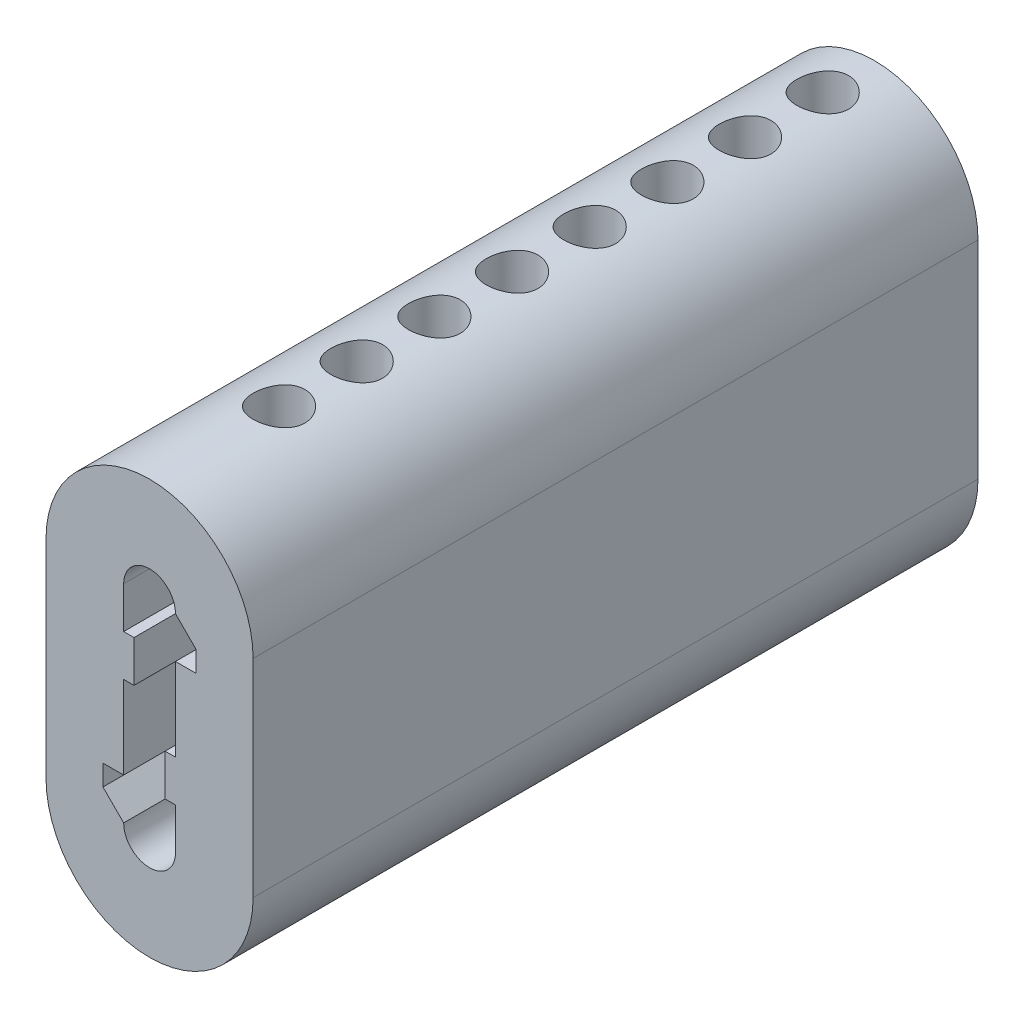
from build123d import *

# Parameters (mm, degrees)
FIRST_EXTURSION_DEPTH = 70
CUT_FOR_KEY_DEPTH     = 70
UPPER_PINS_START      = 9.9999999
UPPER_PINS_OUTLINE_R  = 2.5
UPPER_PINS_DEPTH      = 11.0000001
SZKIC4_W              = 2.5
SZKIC4_H              = 14
DOWN_PINS_AT_2_COUNT  = 2
DOWN_PINS_AT_2_PITCH  = 52.5
DOWN_PINS_AT_3_COUNT  = 2
DOWN_PINS_AT_3_PITCH  = 45
DOWN_PINS_AT_4_COUNT  = 2
DOWN_PINS_AT_4_PITCH  = 37.5
DOWN_PINS_AT_5_COUNT  = 2
DOWN_PINS_AT_5_PITCH  = 30
DOWN_PINS_AT_6_COUNT  = 2
DOWN_PINS_AT_6_PITCH  = 22.5
DOWN_PINS_AT_7_COUNT  = 2
DOWN_PINS_AT_7_PITCH  = 15
DOWN_PINS_AT_8_COUNT  = 2
DOWN_PINS_AT_8_PITCH  = 7.5


with BuildPart() as part:
    # first-extursion-sketch → first-extursion (new body)
    with BuildSketch(Plane.XY):
        with BuildLine():
            Line((-10, -10), (-10, 10))
            ThreePointArc((-10, 10), (0, 20), (10, 10))
            Line((10, 10), (10, -10))
            ThreePointArc((10, -10), (0, -20), (-10, -10))
        make_face()
    extrude(amount=FIRST_EXTURSION_DEPTH)

    # key-hole-sketch → cut-for-key (cut)
    with BuildSketch(Plane.XY.offset(70)):
        with BuildLine():
            Line((-2.5, -6), (-2.5, 2))
            Line((-2.5, 2), (-1.5, 2))
            Line((-1.5, 2), (-1.5, 6))
            Line((-1.5, 6), (-2.5, 6))
            Line((-2.5, 6), (-2.5, 10))
            ThreePointArc((-2.5, 10), (0, 12.5), (2.5, 10))
            Line((2.5, 10), (4.5, 8))
            Line((4.5, 8), (4.5, 6))
            Line((4.5, 6), (2.5, 6))
            Line((2.5, 6), (2.5, -2))
            Line((2.5, -2), (1.5, -2))
            Line((1.5, -2), (1.5, -6))
            Line((1.5, -6), (2.5, -6))
            Line((2.5, -6), (2.5, -10))
            ThreePointArc((2.5, -10), (0, -12.5), (-2.5, -10))
            Line((-2.5, -10), (-4.5, -8))
            Line((-4.5, -8), (-4.5, -6))
            Line((-4.5, -6), (-2.5, -6))
        make_face()
    extrude(amount=-CUT_FOR_KEY_DEPTH, mode=Mode.SUBTRACT)

    # upper-pins: read off the stored shape, not the designer's step
    # upper-pins outline → upper-pins (cut)
    with BuildSketch(Plane(origin=(0, 0, 0), x_dir=(1, 0, 0), z_dir=(0, 1, 0)).offset(UPPER_PINS_START)):
        with Locations((0, -57.5)):
            Circle(UPPER_PINS_OUTLINE_R)
        with Locations((0, -50)):
            Circle(UPPER_PINS_OUTLINE_R)
        with Locations((0, -42.5)):
            Circle(UPPER_PINS_OUTLINE_R)
        with Locations((0, -35)):
            Circle(UPPER_PINS_OUTLINE_R)
        with Locations((0, -27.5)):
            Circle(UPPER_PINS_OUTLINE_R)
        with Locations((0, -20)):
            Circle(UPPER_PINS_OUTLINE_R)
        with Locations((0, -12.5)):
            Circle(UPPER_PINS_OUTLINE_R)
        with Locations((0, -5)):
            Circle(UPPER_PINS_OUTLINE_R)
    extrude(amount=UPPER_PINS_DEPTH, mode=Mode.SUBTRACT)

    # Szkic4 → down-pins (revolve, cut)
    with BuildSketch(Plane(origin=(0, -6, 57.5), x_dir=(0, 0, 1), z_dir=(1, 0, 0))):
        with Locations((1.25, 7)):
            Rectangle(SZKIC4_W, SZKIC4_H)
    down_pins = revolve(axis=Axis((0, 0.35, 57.5), (0, -1, 0)), mode=Mode.SUBTRACT)

    # down-pins at 2: down-pins ×2
    with Locations(*[(0, 0, -i * DOWN_PINS_AT_2_PITCH) for i in range(1, DOWN_PINS_AT_2_COUNT)]):
        add(down_pins, mode=Mode.SUBTRACT)

    # down-pins at 3: down-pins ×2
    with Locations(*[(0, 0, -i * DOWN_PINS_AT_3_PITCH) for i in range(1, DOWN_PINS_AT_3_COUNT)]):
        add(down_pins, mode=Mode.SUBTRACT)

    # down-pins at 4: down-pins ×2
    with Locations(*[(0, 0, -i * DOWN_PINS_AT_4_PITCH) for i in range(1, DOWN_PINS_AT_4_COUNT)]):
        add(down_pins, mode=Mode.SUBTRACT)

    # down-pins at 5: down-pins ×2
    with Locations(*[(0, 0, -i * DOWN_PINS_AT_5_PITCH) for i in range(1, DOWN_PINS_AT_5_COUNT)]):
        add(down_pins, mode=Mode.SUBTRACT)

    # down-pins at 6: down-pins ×2
    with Locations(*[(0, 0, -i * DOWN_PINS_AT_6_PITCH) for i in range(1, DOWN_PINS_AT_6_COUNT)]):
        add(down_pins, mode=Mode.SUBTRACT)

    # down-pins at 7: down-pins ×2
    with Locations(*[(0, 0, -i * DOWN_PINS_AT_7_PITCH) for i in range(1, DOWN_PINS_AT_7_COUNT)]):
        add(down_pins, mode=Mode.SUBTRACT)

    # down-pins at 8: down-pins ×2
    with Locations(*[(0, 0, -i * DOWN_PINS_AT_8_PITCH) for i in range(1, DOWN_PINS_AT_8_COUNT)]):
        add(down_pins, mode=Mode.SUBTRACT)


solid = part.part
